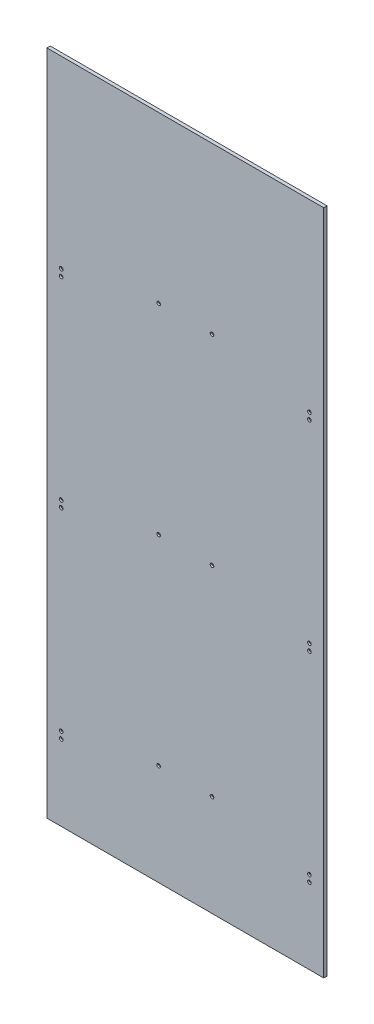
from build123d import *

# Parameters (mm, degrees)
SKETCH1_W                                        = 983.234
SKETCH1_H                                        = 2387.6
BOSS_EXTRUDE1_DEPTH                              = 11.90625
CSK_FOR_1_4_FLAT_HEAD_MACHINE_SCREW1_D           = 6.7564
CSK_FOR_1_4_FLAT_HEAD_MACHINE_SCREW1_CSINK_D     = 12.8778
CSK_FOR_1_4_FLAT_HEAD_MACHINE_SCREW1_CSINK_ANGLE = 82
SKETCH4_W                                        = 983.234
SKETCH4_H                                        = 18.25625
CUT_EXTRUDE1_DEPTH                               = 1595.490727018


with BuildPart() as part:
    # Sketch1 → Boss-Extrude1 (new body)
    with BuildSketch(Plane.XY):
        with Locations((10.033, 319.674875)):
            Rectangle(SKETCH1_W, SKETCH1_H)
    extrude(amount=BOSS_EXTRUDE1_DEPTH)

    # CSK for 1/4 Flat Head Machine Screw1 (through all)
    with Locations(Plane.XY.offset(11.90625)):
        with Locations((-430.784, -562.975125), (-430.784, -586.787625), (-84.709, -496.300125), (104.775, -496.300125), (450.85, -586.787625), (450.85, -562.975125), (450.85, 148.224875), (450.85, 124.412375), (104.775, 214.899875), (-84.709, 214.899875), (-430.784, 124.412375), (-430.784, 148.224875), (-430.784, 859.424875), (-430.784, 835.612375), (-84.709, 926.099875), (104.775, 926.099875), (450.85, 835.612375), (450.85, 859.424875)):
            CounterSinkHole(CSK_FOR_1_4_FLAT_HEAD_MACHINE_SCREW1_D / 2, CSK_FOR_1_4_FLAT_HEAD_MACHINE_SCREW1_CSINK_D / 2, counter_sink_angle=CSK_FOR_1_4_FLAT_HEAD_MACHINE_SCREW1_CSINK_ANGLE)

    # Sketch4 → Cut-Extrude1 (cut, through all)
    with BuildSketch(Plane.XY.offset(11.90625)):
        with Locations((10.033, -864.997)):
            Rectangle(SKETCH4_W, SKETCH4_H)
    extrude(amount=-CUT_EXTRUDE1_DEPTH, mode=Mode.SUBTRACT)


solid = part.part
